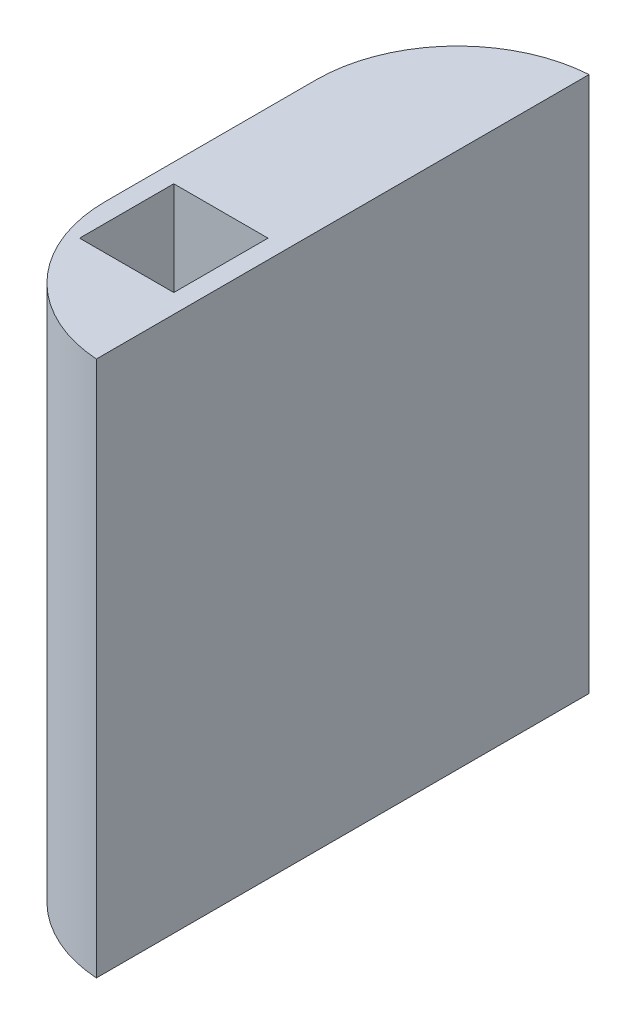
from build123d import *

# Parameters (mm, degrees)
SKETCH_2_W          = 14
SKETCH_2_H          = 52.3
EXTRUDE_1_DEPTH     = 56.9
SKETCH_3_W          = 5
SKETCH_3_H          = 5
CUT_EXTRUDE_1_DEPTH = 56.9
FILLET_6_R          = 15


with BuildPart() as part:
    # Эскиз2 → Бобышка-Вытянуть1 (new body)
    with BuildSketch(Plane(origin=(0, 0, 0), x_dir=(1, 0, 0), z_dir=(0, 1, 0))):
        Rectangle(SKETCH_2_W, SKETCH_2_H)
    extrude(amount=EXTRUDE_1_DEPTH)

    # Эскиз3 → Вырез-Вытянуть1 (cut)
    with BuildSketch(Plane(origin=(0, 56.9, 0), x_dir=(1, 0, 0), z_dir=(0, 1, 0))):
        with Locations((-2.5, -13.43)):
            Rectangle(SKETCH_3_W, SKETCH_3_H)
        with Locations((-2.5, -8.43)):
            Rectangle(SKETCH_3_W, SKETCH_3_H)
        with Locations((2.5, -8.43)):
            Rectangle(SKETCH_3_W, SKETCH_3_H)
        with Locations((2.5, -13.43)):
            Rectangle(SKETCH_3_W, SKETCH_3_H)
    extrude(amount=-CUT_EXTRUDE_1_DEPTH, mode=Mode.SUBTRACT)

    # Скругление6
    # the kernel refuses this fillet: 15 mm, written as the material it takes off along each edge
    with BuildSketch(Plane(origin=(-7, -37.416573868, -26.15), x_dir=(1, 0, 0), z_dir=(0, 1, 0))) as fillet_6_piece_1:
        with BuildLine():
            CenterArc((15, -14.966629547), FILLET_6_R, 93.822553729, 86.177446271)
            Line((0, -14.966629547), (-0.3, -14.966629547))
            Line((-0.3, -14.966629547), (-0.3, 0))
            Line((-0.3, 0), (0, 0.3))
            ThreePointArc((0, 0.3), (7, 0.3), (13.98, 0.299332591))
            Line((13.98, 0.299332591), (14, 0))
        make_face()
    extrude(amount=131.733147735, mode=Mode.SUBTRACT)
    with BuildSketch(Plane(origin=(-7, -37.416573868, 26.15), x_dir=(0, 0, -1), z_dir=(0, 1, 0))) as fillet_6_piece_2:
        with BuildLine():
            CenterArc((14.966629547, -15), FILLET_6_R, 90, 86.177446271)
            Line((0, -14), (-0.299332591, -13.98))
            ThreePointArc((-0.299332591, -13.98), (-0.3, -7), (-0.3, 0))
            Line((-0.3, 0), (0, 0.3))
            Line((0, 0.3), (14.966629547, 0.3))
            Line((14.966629547, 0.3), (14.966629547, 0))
        make_face()
    extrude(amount=131.733147735, mode=Mode.SUBTRACT)


solid = part.part
